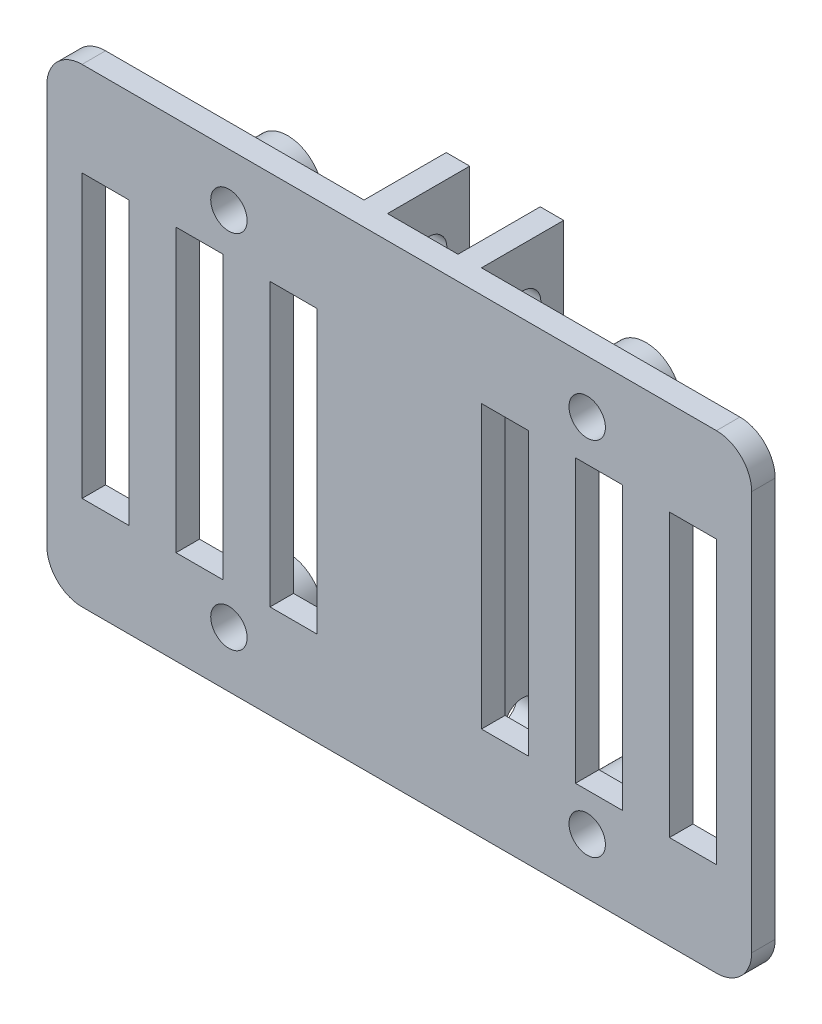
from build123d import *

# Parameters (mm, degrees)
ESQUISSE1_W                  = 60
ESQUISSE1_H                  = 40
BOSS_EXTRU_1_DEPTH           = 9
ESQUISSE2_W                  = 25
ESQUISSE2_H                  = 40
ESQUISSE2_W_2                = 6
ENL_V_MAT_EXTRU_1_DEPTH      = 7
ESQUISSE3_R                  = 1.55
ENL_V_MAT_EXTRU_2_DEPTH      = 54.907327888
CONG_1_R                     = 3
ESQUISSE9_R                  = 3
BOSS_EXTRU_2_DEPTH           = 3
ENL_V_MAT_EXTRU_4_DEPTH      = 73.449982747
ENL_V_MAT_EXTRU_4_DEPTH_BACK = 73.449982747
ESQUISSE5_R                  = 1.55
ESQUISSE8_W                  = 4
ESQUISSE8_H                  = 24
ENL_V_MAT_EXTRU_5_DEPTH      = 7
ESQUISSE6_W                  = 4
ESQUISSE6_H                  = 24
ENL_V_MAT_EXTRU_6_DEPTH      = 7


with BuildPart() as part:
    # Esquisse1 → Boss.-Extru.1 (new body)
    with BuildSketch(Plane.XY):
        with Locations((30, 20)):
            Rectangle(ESQUISSE1_W, ESQUISSE1_H)
    extrude(amount=BOSS_EXTRU_1_DEPTH)

    # Esquisse2 → Enlèv. mat.-Extru.1 (cut)
    with BuildSketch(Plane(origin=(0, 0, 0), x_dir=(-1, 0, 0), z_dir=(0, 0, -1))):
        with Locations((-12.5, 20)):
            Rectangle(ESQUISSE2_W, ESQUISSE2_H)
        with Locations((-47.5, 20)):
            Rectangle(ESQUISSE2_W, ESQUISSE2_H)
        with Locations((-30, 20)):
            Rectangle(ESQUISSE2_W_2, ESQUISSE2_H)
    extrude(amount=-ENL_V_MAT_EXTRU_1_DEPTH, mode=Mode.SUBTRACT)

    # Esquisse3 → Enlèv. mat.-Extru.2 (cut, through all)
    with BuildSketch(Plane(origin=(35, 0, 0), x_dir=(0, 0, -1), z_dir=(1, 0, 0))):
        with Locations((-3.5, 5)):
            Circle(ESQUISSE3_R)
        with Locations((-3.5, 35)):
            Circle(ESQUISSE3_R)
    extrude(amount=-ENL_V_MAT_EXTRU_2_DEPTH, mode=Mode.SUBTRACT)

    # Congé1
    cong_1_edges = [part.edges().sort_by_distance(p)[0] for p in [
        (0, 0, 8),
        (60, 0, 8),
        (0, 40, 8),
        (60, 40, 8),
    ]]
    fillet(cong_1_edges, radius=CONG_1_R)

    # Esquisse9 → Boss.-Extru.2 (add)
    with BuildSketch(Plane(origin=(0, 0, 7), x_dir=(-1, 0, 0), z_dir=(0, 0, -1))):
        with Locations((-46, 35.5)):
            Circle(ESQUISSE9_R)
        with Locations((-15.5, 35.5)):
            Circle(ESQUISSE9_R)
        with Locations((-15.5, 4.75)):
            Circle(ESQUISSE9_R)
        with Locations((-46, 4.75)):
            Circle(ESQUISSE9_R)
    extrude(amount=BOSS_EXTRU_2_DEPTH)

    # Esquisse5 → Enlèv. mat.-Extru.4 (cut, two sides: drawn at the far end of the back side and taken through both)
    with BuildSketch(Plane(origin=(0, 0, 7), x_dir=(-1, 0, 0), z_dir=(0, 0, -1)).offset(-ENL_V_MAT_EXTRU_4_DEPTH_BACK)):
        with Locations((-46, 35.5)):
            Circle(ESQUISSE5_R)
        with Locations((-46, 4.75)):
            Circle(ESQUISSE5_R)
        with Locations((-15.5, 4.75)):
            Circle(ESQUISSE5_R)
        with Locations((-15.5, 35.5)):
            Circle(ESQUISSE5_R)
    extrude(amount=ENL_V_MAT_EXTRU_4_DEPTH + ENL_V_MAT_EXTRU_4_DEPTH_BACK, mode=Mode.SUBTRACT)

    # Esquisse8 → Enlèv. mat.-Extru.5 (cut)
    with BuildSketch(Plane(origin=(0, 0, 7), x_dir=(-1, 0, 0), z_dir=(0, 0, -1))):
        with Locations((-13, 20)):
            Rectangle(ESQUISSE8_W, ESQUISSE8_H)
        with Locations((-5, 20)):
            Rectangle(ESQUISSE8_W, ESQUISSE8_H)
        with Locations((-21, 20)):
            Rectangle(ESQUISSE8_W, ESQUISSE8_H)
    extrude(amount=-ENL_V_MAT_EXTRU_5_DEPTH, mode=Mode.SUBTRACT)

    # Esquisse6 → Enlèv. mat.-Extru.6 (cut)
    with BuildSketch(Plane(origin=(0, 0, 7), x_dir=(-1, 0, 0), z_dir=(0, 0, -1))):
        with Locations((-47, 20)):
            Rectangle(ESQUISSE6_W, ESQUISSE6_H)
        with Locations((-55, 20)):
            Rectangle(ESQUISSE6_W, ESQUISSE6_H)
        with Locations((-39, 20)):
            Rectangle(ESQUISSE6_W, ESQUISSE6_H)
    extrude(amount=-ENL_V_MAT_EXTRU_6_DEPTH, mode=Mode.SUBTRACT)


solid = part.part
